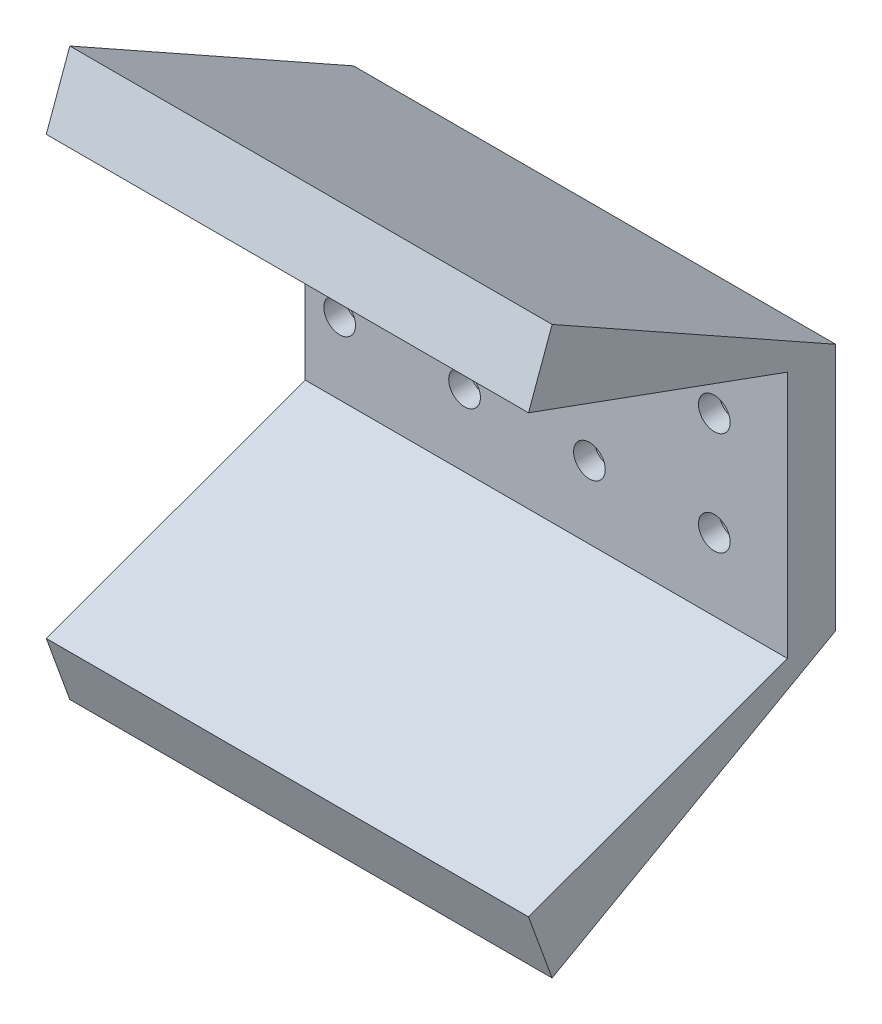
from build123d import *

# Parameters (mm, degrees)
ESQUISSE1_W             = 70
ESQUISSE1_H             = 36
ESQUISSE1_R             = 2.3
BOSS_EXTRU_1_DEPTH      = 7
ESQUISSE2_R             = 4
ENL_V_MAT_EXTRU_1_DEPTH = 4
BOSS_EXTRU_2_DEPTH      = 70


with BuildPart() as part:
    # Esquisse1 → Boss.-Extru.1 (new body)
    with BuildSketch(Plane.XY):
        with Locations((35, 18)):
            Rectangle(ESQUISSE1_W, ESQUISSE1_H)
        with Locations((5, 25.5)):
            Circle(ESQUISSE1_R, mode=Mode.SUBTRACT)
        with Locations((5, 10.5)):
            Circle(ESQUISSE1_R, mode=Mode.SUBTRACT)
        with Locations((23.125, 25.5)):
            Circle(ESQUISSE1_R, mode=Mode.SUBTRACT)
        with Locations((23.125, 10.5)):
            Circle(ESQUISSE1_R, mode=Mode.SUBTRACT)
        with Locations((41.25, 25.5)):
            Circle(ESQUISSE1_R, mode=Mode.SUBTRACT)
        with Locations((41.25, 10.5)):
            Circle(ESQUISSE1_R, mode=Mode.SUBTRACT)
        with Locations((59.375, 25.5)):
            Circle(ESQUISSE1_R, mode=Mode.SUBTRACT)
        with Locations((59.375, 10.5)):
            Circle(ESQUISSE1_R, mode=Mode.SUBTRACT)
    extrude(amount=BOSS_EXTRU_1_DEPTH)

    # Esquisse2 → Enlèv. mat.-Extru.1 (cut)
    with BuildSketch(Plane(origin=(0, 0, 0), x_dir=(-1, 0, 0), z_dir=(0, 0, -1))):
        with Locations((-59.375, 25.5)):
            Circle(ESQUISSE2_R)
        with Locations((-41.25, 25.5)):
            Circle(ESQUISSE2_R)
        with Locations((-23.125, 25.5)):
            Circle(ESQUISSE2_R)
        with Locations((-5, 25.5)):
            Circle(ESQUISSE2_R)
        with Locations((-5, 10.5)):
            Circle(ESQUISSE2_R)
        with Locations((-23.125, 10.5)):
            Circle(ESQUISSE2_R)
        with Locations((-41.25, 10.5)):
            Circle(ESQUISSE2_R)
        with Locations((-59.375, 10.5)):
            Circle(ESQUISSE2_R)
    extrude(amount=-ENL_V_MAT_EXTRU_1_DEPTH, mode=Mode.SUBTRACT)

    # Esquisse3 → Boss.-Extru.2 (add)
    with BuildSketch(Plane(origin=(70, 0, 0), x_dir=(0, 0, -1), z_dir=(1, 0, 0))):
        Polygon((-44.587704831, 49.680805733), (-7, 36), (0, 36), (-41.167503398, 59.077731941), align=None)
        Polygon((0, 0), (-7, 0), (-44.587704831, -13.680805733), (-41.167503398, -23.077731941), align=None)
    extrude(amount=-BOSS_EXTRU_2_DEPTH)


solid = part.part
